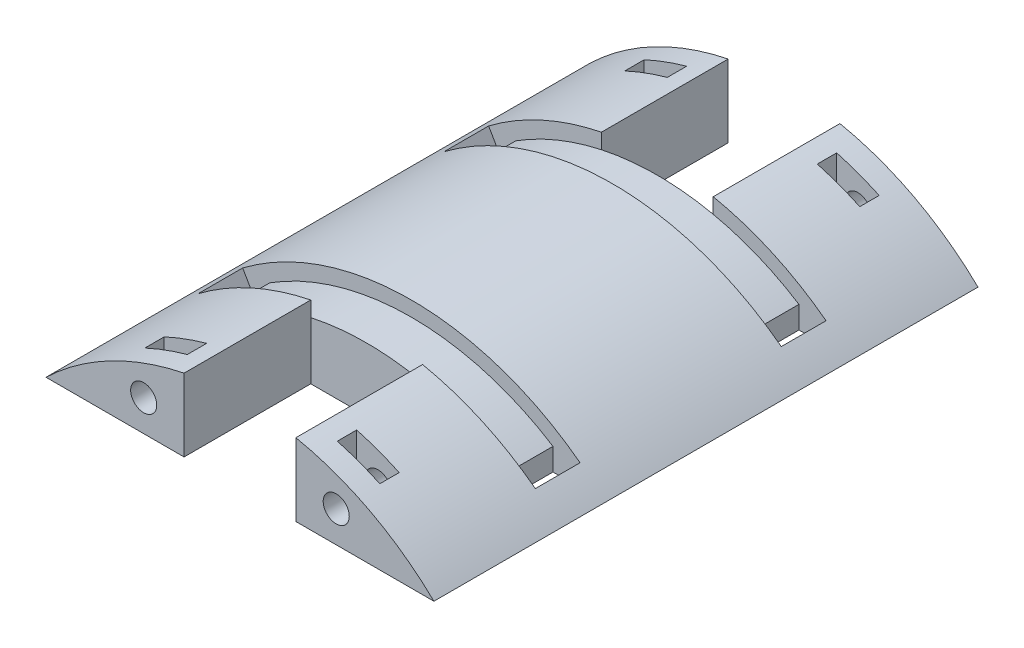
from build123d import *

# Parameters (mm, degrees)
BOSS_EXTRU_2_DEPTH       = 73
ESQUISSE7_R              = 1.75
ENL_V_MAT_EXTRU_4_DEPTH  = 12
ENL_V_START              = -5.6
ENL_V_MAT_EXTRU_5_DEPTH  = 2.6
ENL_V_START_2            = -12
ESQUISSE12_R             = 1.75
ENL_V_MAT_EXTRU_6_DEPTH  = 12
ENL_V_START_3            = -3
ENL_V_MAT_EXTRU_7_DEPTH  = 2.6
ESQUISSE21_W             = 15
ESQUISSE21_H             = 17
ENL_V_MAT_EXTRU_14_DEPTH = 79.208055851
ESQUISSE22_W             = 2
ESQUISSE22_H             = 6
ENL_V_MAT_EXTRU_15_DEPTH = 79.208055851
ENL_V_START_4            = -17
ENL_V_MAT_EXTRU_17_DEPTH = 6
ENL_V_START_5            = -23
ENL_V_MAT_EXTRU_19_DEPTH = 6
CHANFREIN1_SIZE          = 4
CHANFREIN2_SIZE          = 4


with BuildPart() as part:
    # Esquisse3 → Boss.-Extru.2 (new body)
    with BuildSketch(Plane.XY):
        with BuildLine():
            ThreePointArc((-26.024027359, 27), (0, 37.5), (26.024027359, 27))
            Line((26.024027359, 27), (13.076696831, 27))
            Line((13.076696831, 27), (-13.076696831, 27))
            Line((-13.076696831, 27), (-26.024027359, 27))
        make_face()
    extrude(amount=BOSS_EXTRU_2_DEPTH)

    # Esquisse7 → Enlèv. mat.-Extru.4 (cut)
    with BuildSketch(Plane.XY.offset(73)):
        with Locations((-12.915565842, 31.180934222)):
            Circle(ESQUISSE7_R)
        with Locations((12.915565842, 31.180934222)):
            Circle(ESQUISSE7_R)
    extrude(amount=-ENL_V_MAT_EXTRU_4_DEPTH, mode=Mode.SUBTRACT)

    # Esquisse11 → Enlèv. mat.-Extru.5 (cut)
    with BuildSketch(Plane.XY.offset(73).offset(ENL_V_START)):
        with BuildLine():
            Line((-15.765565842, 31.180934222), (-15.765565842, 34.024945756))
            ThreePointArc((-15.765565842, 34.024945756), (-12.95813326, 35.190009696), (-10.065565842, 36.123875543))
            Line((-10.065565842, 36.123875543), (-10.065565842, 29.426382489))
            Line((-10.065565842, 29.426382489), (-12.915565842, 27.780934222))
            Line((-12.915565842, 27.780934222), (-15.765565842, 29.426382489))
            Line((-15.765565842, 29.426382489), (-15.765565842, 31.180934222))
        make_face()
        with BuildLine():
            Line((10.065565842, 36.123875543), (10.065565842, 29.426382489))
            Line((10.065565842, 29.426382489), (12.915565842, 27.780934222))
            Line((12.915565842, 27.780934222), (15.765565842, 29.426382489))
            Line((15.765565842, 29.426382489), (15.765565842, 34.024945756))
            ThreePointArc((15.765565842, 34.024945756), (12.95813326, 35.190009696), (10.065565842, 36.123875543))
        make_face()
    extrude(amount=ENL_V_MAT_EXTRU_5_DEPTH, mode=Mode.SUBTRACT)

    # Esquisse12 → Enlèv. mat.-Extru.6 (cut)
    with BuildSketch(Plane(origin=(0, 0, 0), x_dir=(-1, 0, 0), z_dir=(0, 0, -1)).offset(ENL_V_START_2)):
        with Locations(Location((-12.915565842, 31.180934222, 0), (0, 0, 180))):
            Circle(ESQUISSE12_R)
        with Locations(Location((12.915565842, 31.180934222, 0), (0, 0, 180))):
            Circle(ESQUISSE12_R)
    extrude(amount=ENL_V_MAT_EXTRU_6_DEPTH, mode=Mode.SUBTRACT)

    # Esquisse14 → Enlèv. mat.-Extru.7 (cut)
    with BuildSketch(Plane(origin=(0, 0, 0), x_dir=(-1, 0, 0), z_dir=(0, 0, -1)).offset(ENL_V_START_3)):
        with BuildLine():
            Line((-15.765565842, 31.689067965), (-15.765565842, 34.024945756))
            ThreePointArc((-15.765565842, 34.024945756), (-12.95813326, 35.190009696), (-10.065565842, 36.123875543))
            Line((-10.065565842, 36.123875543), (-10.065565842, 29.426382489))
            Line((-10.065565842, 29.426382489), (-12.915565842, 27.780934222))
            Line((-12.915565842, 27.780934222), (-15.765565842, 29.426382489))
            Line((-15.765565842, 29.426382489), (-15.765565842, 31.689067965))
        make_face()
        with BuildLine():
            Line((10.065565842, 36.123875543), (10.065565842, 29.426382489))
            Line((10.065565842, 29.426382489), (12.915565842, 27.780934222))
            Line((12.915565842, 27.780934222), (15.765565842, 29.426382489))
            Line((15.765565842, 29.426382489), (15.765565842, 34.024945756))
            ThreePointArc((15.765565842, 34.024945756), (12.95813326, 35.190009696), (10.065565842, 36.123875543))
        make_face()
    extrude(amount=-ENL_V_MAT_EXTRU_7_DEPTH, mode=Mode.SUBTRACT)

    # Esquisse21 → Enlèv. mat.-Extru.14 (cut, through all)
    with BuildSketch(Plane.XZ.offset(-27)):
        with Locations((0, 64.5)):
            Rectangle(ESQUISSE21_W, ESQUISSE21_H)
        with Locations((0, 8.5)):
            Rectangle(ESQUISSE21_W, ESQUISSE21_H)
    extrude(amount=-ENL_V_MAT_EXTRU_14_DEPTH, mode=Mode.SUBTRACT)

    # Esquisse22 → Enlèv. mat.-Extru.15 (cut, through all)
    with BuildSketch(Plane.XZ.offset(-27)):
        with Locations((-20, 53)):
            Rectangle(ESQUISSE22_W, ESQUISSE22_H)
        with Locations((20, 53)):
            Rectangle(ESQUISSE22_W, ESQUISSE22_H)
        with Locations((-20, 20)):
            Rectangle(ESQUISSE22_W, ESQUISSE22_H)
        with Locations((20, 20)):
            Rectangle(ESQUISSE22_W, ESQUISSE22_H)
    extrude(amount=-ENL_V_MAT_EXTRU_15_DEPTH, mode=Mode.SUBTRACT)

    # Esquisse23 → Enlèv. mat.-Extru.17 (cut)
    with BuildSketch(Plane(origin=(0, 0, 0), x_dir=(-1, 0, 0), z_dir=(0, 0, -1)).offset(ENL_V_START_4)):
        with BuildLine():
            Line((-19, 29.987497395), (-19, 32.330326321))
            ThreePointArc((-19, 32.330326321), (0, 37.5), (19, 32.330326321))
            Line((19, 32.330326321), (19, 29.987497395))
            ThreePointArc((19, 29.987497395), (0, 35.5), (-19, 29.987497395))
        make_face()
    extrude(amount=-ENL_V_MAT_EXTRU_17_DEPTH, mode=Mode.SUBTRACT)

    # Esquisse27 → Enlèv. mat.-Extru.19 (cut)
    with BuildSketch(Plane.XY.offset(73).offset(ENL_V_START_5)):
        with BuildLine():
            Line((-19, 32.330326321), (-19, 29.987497395))
            ThreePointArc((-19, 29.987497395), (0, 35.5), (19, 29.987497395))
            Line((19, 29.987497395), (19, 32.330326321))
            ThreePointArc((19, 32.330326321), (0, 37.5), (-19, 32.330326321))
        make_face()
    extrude(amount=ENL_V_MAT_EXTRU_19_DEPTH, mode=Mode.SUBTRACT)

    # Chanfrein1
    # the kernel refuses this chamfer: 4, 2.005021286 mm, written as the material it takes off along each edge
    with BuildSketch(Plane(origin=(21, 31.068472766, 56), x_dir=(0.8131904360311143, -0.581997693077495, 0), z_dir=(0, 0, -1)), Plane(origin=(21, 31.068472766, 23), x_dir=(0.8131904360311155, -0.5819976930774934, 0), z_dir=(0, 0, -1))) as chanfrein1_piece_1:
        with BuildLine():
            Line((2.009560641, 0), (CHANFREIN1_SIZE * 0.581997693077, CHANFREIN1_SIZE * 0.813190436031))
            Line((CHANFREIN1_SIZE * 0.581997693077, CHANFREIN1_SIZE * 0.813190436031), (0, 0))
            ThreePointArc((0, 0), (0.996999681, -0.013462723), (2.009560641, 0))
        make_face()
    extrude(amount=6, mode=Mode.SUBTRACT)

    # Chanfrein2
    # the kernel refuses this chamfer: 4, 2.005021286 mm, written as the material it takes off along each edge
    with BuildSketch(Plane(origin=(-21, 31.068472766, 23), x_dir=(-0.8131904360311136, -0.5819976930774963, 0), z_dir=(0, 0, -1)), Plane(origin=(-21, 31.068472766, 56), x_dir=(-0.8131904360311129, -0.581997693077497, 0), z_dir=(0, 0, -1))) as chanfrein2_piece_1:
        with BuildLine():
            Line((2.009560641, 0), (CHANFREIN2_SIZE * 0.581997693077, -CHANFREIN2_SIZE * 0.813190436031))
            Line((CHANFREIN2_SIZE * 0.581997693077, -CHANFREIN2_SIZE * 0.813190436031), (0, 0))
            ThreePointArc((0, 0), (0.996999681, 0.013462723), (2.009560641, 0))
        make_face()
    extrude(amount=6, mode=Mode.SUBTRACT)


solid = part.part
